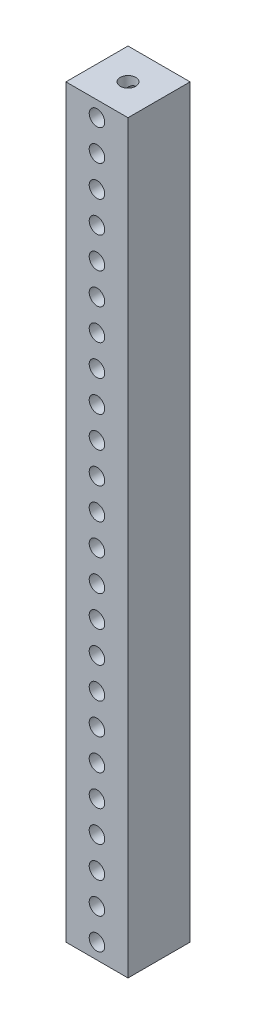
from build123d import *

# Parameters (mm, degrees)
SKETCH1_W           = 20
SKETCH1_H           = 20
SKETCH1_R           = 2.5
BOSS_EXTRUDE1_DEPTH = 240
SKETCH2_R           = 2.5
CUT_EXTRUDE1_DEPTH  = 100
LPATTERN1_COUNT     = 22
LPATTERN1_PITCH     = 10
SKETCH3_R           = 2.5
CUT_EXTRUDE2_DEPTH  = 242.039415864


with BuildPart() as part:
    # Sketch1 → Boss-Extrude1 (new body)
    with BuildSketch(Plane(origin=(0, 0, 0), x_dir=(1, 0, 0), z_dir=(0, 1, 0))):
        Rectangle(SKETCH1_W, SKETCH1_H)
        Circle(SKETCH1_R, mode=Mode.SUBTRACT)
    extrude(amount=BOSS_EXTRUDE1_DEPTH)

    # Sketch2 → Cut-Extrude1 (cut)
    with BuildSketch(Plane.XY.offset(10)):
        with Locations((0, 5)):
            Circle(SKETCH2_R)
    cut_extrude1 = extrude(amount=-CUT_EXTRUDE1_DEPTH, mode=Mode.SUBTRACT)

    # LPattern1: Cut-Extrude1 ×22
    with Locations(*[(0, i * LPATTERN1_PITCH, 0) for i in range(1, LPATTERN1_COUNT)]):
        add(cut_extrude1, mode=Mode.SUBTRACT)

    # Sketch3 → Cut-Extrude2 (cut, through all)
    with BuildSketch(Plane.XY.offset(10)):
        with Locations((0, 235)):
            Circle(SKETCH3_R)
        with Locations((0, 225)):
            Circle(SKETCH3_R)
    extrude(amount=-CUT_EXTRUDE2_DEPTH, mode=Mode.SUBTRACT)


solid = part.part
